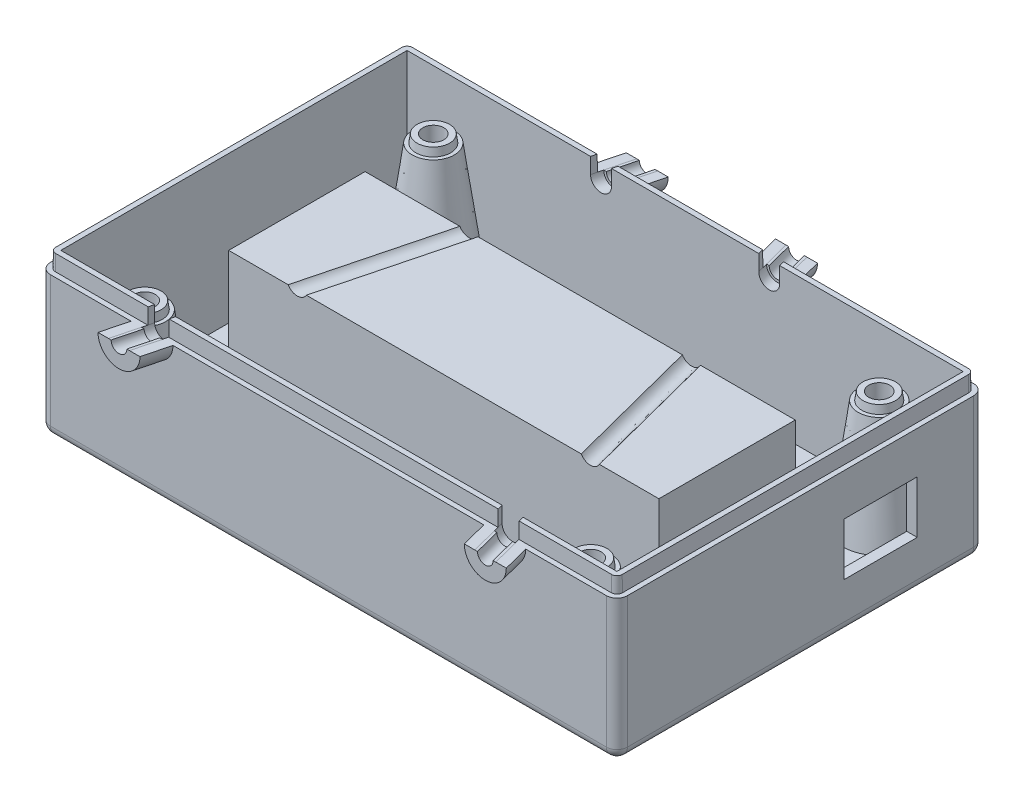
from build123d import *

# Parameters (mm, degrees)
SKETCH2_W           = 110
SKETCH2_H           = 70
BOSS_EXTRUDE1_DEPTH = 30
FILLET1_R           = 2
SKETCH10_W          = 78
SKETCH10_H          = 22
CUT_EXTRUDE2_DEPTH  = 24
CUT_EXTRUDE6_DEPTH  = 2
SKETCH14_R          = 2
CUT_EXTRUDE7_DEPTH  = 6
SHELL1_START        = 4
SHELL1_OUTLINE_W    = 106
SHELL1_OUTLINE_H    = 66
SHELL1_DEPTH        = 26
SHELL1_START_2      = 26
SHELL1_2_DEPTH      = 4
SHELL1_START_3      = 2
SHELL1_3_OUTLINE_W  = 106
SHELL1_3_OUTLINE_H  = 66
SHELL1_3_DEPTH      = 2
SHELL1_START_4      = 10
SHELL1_4_DEPTH      = 16
SKETCH4_OUTSIDE_W   = 138.862
SKETCH4_OUTSIDE_H   = 98.862
CUT_EXTRUDE1_DEPTH  = 3
CUT_EXTRUDE1_DRAFT  = -1
SKETCH11_R          = 2
CUT_EXTRUDE3_DEPTH  = 2
SKETCH12_R          = 2
CUT_EXTRUDE4_DEPTH  = 2
SKETCH29_W          = 14
SKETCH29_H          = 10
CUT_EXTRUDE8_DEPTH  = 5
SKETCH30_W          = 40
SKETCH30_H          = 1.5
CUT_EXTRUDE9_DEPTH  = 10
SKETCH32_W          = 40
SKETCH32_H          = 1.5
CUT_EXTRUDE10_DEPTH = 10


# Read off the part's stored shape, not the designer's step: Shell1, Mounting Boss3, Mounting Boss4, Mounting Boss5, Mounting Boss6
with BuildPart() as part:
    # Sketch2 → Boss-Extrude1 (new body)
    with BuildSketch(Plane(origin=(0, 0, 0), x_dir=(1, 0, 0), z_dir=(0, 1, 0))):
        Rectangle(SKETCH2_W, SKETCH2_H)
    extrude(amount=BOSS_EXTRUDE1_DEPTH)

    # Fillet1
    fillet1_edges = [part.edges().sort_by_distance(p)[0] for p in [
        (0, 0, 35),
        (-55, 0, 0),
        (0, 0, -35),
        (55, 0, 0),
        (55, 15, 35),
        (-55, 15, 35),
        (-55, 15, -35),
        (55, 15, -35),
    ]]
    fillet(fillet1_edges, radius=FILLET1_R)

    # Sketch10 → Cut-Extrude2 (cut)
    with BuildSketch(Plane.XZ):
        Rectangle(SKETCH10_W, SKETCH10_H)
    extrude(amount=-CUT_EXTRUDE2_DEPTH, mode=Mode.SUBTRACT)

    # Sketch13 → Cut-Extrude6 (cut)
    with BuildSketch(Plane.XZ):
        with BuildLine():
            Line((6, -14), (42, -14))
            Line((42, -14), (42, 14))
            Line((42, 14), (6, 14))
            ThreePointArc((6, 14), (0, 20), (-6, 14))
            Line((-6, 14), (-42, 14))
            Line((-42, 14), (-42, -14))
            Line((-42, -14), (-6, -14))
            ThreePointArc((-6, -14), (0, -20), (6, -14))
        make_face()
    extrude(amount=-CUT_EXTRUDE6_DEPTH, mode=Mode.SUBTRACT)

    # Sketch14 → Cut-Extrude7 (cut)
    with BuildSketch(Plane.XZ.offset(-2)):
        with Locations(Location((0, -16, 0), (0, 0, 270))):
            Circle(SKETCH14_R)
        with Locations(Location((0, 16, 0), (0, 0, 270))):
            Circle(SKETCH14_R)
    extrude(amount=-CUT_EXTRUDE7_DEPTH, mode=Mode.SUBTRACT)

    # Shell1 outline → Shell1 (cut)
    with BuildSketch(Plane(origin=(0, 0, 0), x_dir=(1, 0, 0), z_dir=(0, 1, 0)).offset(SHELL1_START)):
        Rectangle(SHELL1_OUTLINE_W, SHELL1_OUTLINE_H)
        with BuildLine():
            Line((2.645751311, 13), (41, 13))
            Line((41, 13), (41, -13))
            Line((41, -13), (2.645751311, -13))
            ThreePointArc((2.645751311, -13), (0, -20), (-2.645751311, -13))
            Line((-2.645751311, -13), (-41, -13))
            Line((-41, -13), (-41, 13))
            Line((-41, 13), (-2.645751311, 13))
            ThreePointArc((-2.645751311, 13), (0, 20), (2.645751311, 13))
        make_face(mode=Mode.SUBTRACT)
    extrude(amount=SHELL1_DEPTH, mode=Mode.SUBTRACT)

    # Shell1 2 outline → Shell1 2 (cut)
    with BuildSketch(Plane(origin=(0, 0, 0), x_dir=(1, 0, 0), z_dir=(0, 1, 0)).offset(SHELL1_START_2)):
        with BuildLine():
            Line((41, -13), (41, 13))
            Line((41, 13), (2.645751311, 13))
            ThreePointArc((2.645751311, 13), (0, 20), (-2.645751311, 13))
            Line((-2.645751311, 13), (-41, 13))
            Line((-41, 13), (-41, -13))
            Line((-41, -13), (-2.645751311, -13))
            ThreePointArc((-2.645751311, -13), (0, -20), (2.645751311, -13))
            Line((2.645751311, -13), (41, -13))
        make_face()
    extrude(amount=SHELL1_2_DEPTH, mode=Mode.SUBTRACT)

    # Shell1 3 outline → Shell1 3 (cut)
    with BuildSketch(Plane(origin=(0, 0, 0), x_dir=(1, 0, 0), z_dir=(0, 1, 0)).offset(SHELL1_START_3)):
        Rectangle(SHELL1_3_OUTLINE_W, SHELL1_3_OUTLINE_H)
        with BuildLine():
            Line((44, -16), (7.745966692, -16))
            ThreePointArc((7.745966692, -16), (0, -22), (-7.745966692, -16))
            Line((-7.745966692, -16), (-44, -16))
            Line((-44, -16), (-44, 16))
            Line((-44, 16), (-7.745966692, 16))
            ThreePointArc((-7.745966692, 16), (0, 22), (7.745966692, 16))
            Line((7.745966692, 16), (44, 16))
            Line((44, 16), (44, -16))
        make_face(mode=Mode.SUBTRACT)
    extrude(amount=SHELL1_3_DEPTH, mode=Mode.SUBTRACT)

    # Shell1 4 outline → Shell1 4 (cut)
    with BuildSketch(Plane(origin=(0, 0, 0), x_dir=(1, 0, 0), z_dir=(0, 1, 0)).offset(SHELL1_START_4)):
        with BuildLine():
            Line((-2.645751311, 13), (2.645751311, 13))
            ThreePointArc((2.645751311, 13), (0, 20), (-2.645751311, 13))
        make_face()
        with BuildLine():
            ThreePointArc((-2.645751311, -13), (0, -20), (2.645751311, -13))
            Line((2.645751311, -13), (-2.645751311, -13))
        make_face()
    extrude(amount=SHELL1_4_DEPTH, mode=Mode.SUBTRACT)


with BuildPart() as cut_extrude1_tool:
    # Sketch4 outside → Cut-Extrude1 (with draft: the straight prism first)
    with BuildSketch(Plane(origin=(0, 30, 0), x_dir=(1, 0, 0), z_dir=(0, 1, 0))):
        Rectangle(SKETCH4_OUTSIDE_W, SKETCH4_OUTSIDE_H)
        with BuildLine():
            Line((54, -33), (54, 33))
            ThreePointArc((54, 33), (53.707106781, 33.707106781), (53, 34))
            Line((53, 34), (-53, 34))
            ThreePointArc((-53, 34), (-53.707106781, 33.707106781), (-54, 33))
            Line((-54, 33), (-54, -33))
            ThreePointArc((-54, -33), (-53.707106781, -33.707106781), (-53, -34))
            Line((-53, -34), (53, -34))
            ThreePointArc((53, -34), (53.707106781, -33.707106781), (54, -33))
        make_face(mode=Mode.SUBTRACT)
    extrude(amount=-CUT_EXTRUDE1_DEPTH)
    # Cut-Extrude1: the draft: its side faces are tilted about the plane it starts from
    cut_extrude1_sides = [cut_extrude1_tool.faces().sort_by_distance(p)[0] for p in [
        (0, 28.5, 49.431),
        (69.431, 28.5, 0),
        (0, 28.5, -49.431),
        (-69.431, 28.5, 0),
        (0, 28.5, 34),
        (-53.707106781, 28.5, 33.707106781),
        (-54, 28.5, 0),
        (-53.707106781, 28.5, -33.707106781),
        (0, 28.5, -34),
        (53.707106781, 28.5, -33.707106781),
        (54, 28.5, 0),
        (53.707106781, 28.5, 33.707106781),
    ]]
    draft(cut_extrude1_sides, Plane(origin=(0, 30, 0), x_dir=(1, 0, 0), z_dir=(0, 1, 0)), CUT_EXTRUDE1_DRAFT)


with BuildPart() as part_1:
    add(part.part)

    # Cut-Extrude1: cut by cut_extrude1_tool
    add(cut_extrude1_tool.part, mode=Mode.SUBTRACT)

    # Mounting Boss3 outline → Mounting Boss3 (revolve, cut)
    with BuildSketch(Plane(origin=(42.5, 0, -27.5), x_dir=(1, 0, 0), z_dir=(0, 0, 1))):
        Polygon((4.222482258, 0), (4.187572131, 1.999999827), (0, 1.999999827), (0, 0), align=None)
    revolve(axis=Axis((42.5, 0, -27.5), (0, 1, 0)), mode=Mode.SUBTRACT)

    # Mounting Boss3 2 outline → Mounting Boss3 2 (revolve)
    with BuildSketch(Plane(origin=(42.5, 0, -27.5), x_dir=(1, 0, 0), z_dir=(0, 0, 1))):
        Polygon((4, 22.746), (3.310811252, 22.746), (3.1, 24.246), (2, 24.246), (2, 12.746), (4, 12.746), (4.187572131, 1.999999827), (6.916385707, 1.999999827), align=None)
    revolve(axis=Axis((42.5, 0, -27.5), (0, 1, 0)))

    # Mounting Boss4 outline → Mounting Boss4 (revolve, cut)
    with BuildSketch(Plane(origin=(42.5, 0, 27.5), x_dir=(1, 0, 0), z_dir=(0, 0, 1))):
        Polygon((4.222482258, 0), (4.187572131, 1.999999827), (0, 1.999999827), (0, 0), align=None)
    revolve(axis=Axis((42.5, 0, 27.5), (0, 1, 0)), mode=Mode.SUBTRACT)

    # Mounting Boss4 2 outline → Mounting Boss4 2 (revolve)
    with BuildSketch(Plane(origin=(42.5, 0, 27.5), x_dir=(1, 0, 0), z_dir=(0, 0, 1))):
        Polygon((4, 22.746), (3.310811252, 22.746), (3.1, 24.246), (2, 24.246), (2, 12.746), (4, 12.746), (4.187572131, 1.999999827), (6.916385707, 1.999999827), align=None)
    revolve(axis=Axis((42.5, 0, 27.5), (0, 1, 0)))

    # Mounting Boss5 outline → Mounting Boss5 (revolve, cut)
    with BuildSketch(Plane(origin=(-42.5, 0, -27.5), x_dir=(1, 0, 0), z_dir=(0, 0, 1))):
        Polygon((4.222482258, 0), (4.187572133, 1.999999739), (0, 1.999999739), (0, 0), align=None)
    revolve(axis=Axis((-42.5, 0, -27.5), (0, 1, 0)), mode=Mode.SUBTRACT)

    # Mounting Boss5 2 outline → Mounting Boss5 2 (revolve)
    with BuildSketch(Plane(origin=(-42.5, 0, -27.5), x_dir=(1, 0, 0), z_dir=(0, 0, 1))):
        Polygon((4, 22.746), (3.310811252, 22.746), (3.1, 24.246), (2, 24.246), (2, 12.746), (4, 12.746), (4.187572133, 1.999999739), (6.916385719, 1.999999739), align=None)
    revolve(axis=Axis((-42.5, 0, -27.5), (0, 1, 0)))

    # Mounting Boss6 outline → Mounting Boss6 (revolve, cut)
    with BuildSketch(Plane(origin=(-42.5, 0, 27.5), x_dir=(1, 0, 0), z_dir=(0, 0, 1))):
        Polygon((4.222482258, 0), (4.187572133, 1.999999739), (0, 1.999999739), (0, 0), align=None)
    revolve(axis=Axis((-42.5, 0, 27.5), (0, 1, 0)), mode=Mode.SUBTRACT)

    # Mounting Boss6 2 outline → Mounting Boss6 2 (revolve)
    with BuildSketch(Plane(origin=(-42.5, 0, 27.5), x_dir=(1, 0, 0), z_dir=(0, 0, 1))):
        Polygon((4, 22.746), (3.310811252, 22.746), (3.1, 24.246), (2, 24.246), (2, 12.746), (4, 12.746), (4.187572133, 1.999999739), (6.916385719, 1.999999739), align=None)
    revolve(axis=Axis((-42.5, 0, 27.5), (0, 1, 0)))

    # Sketch11 → Cut-Extrude3 (cut)
    with BuildSketch(Plane(origin=(41, 0, 0), x_dir=(0, 0, -1), z_dir=(1, 0, 0))):
        with Locations((0, 14)):
            Circle(SKETCH11_R)
    extrude(amount=-CUT_EXTRUDE3_DEPTH, mode=Mode.SUBTRACT)

    # Sketch12 → Cut-Extrude4 (cut)
    with BuildSketch(Plane.ZY.offset(41)):
        with Locations((0, 13)):
            Circle(SKETCH12_R)
    extrude(amount=-CUT_EXTRUDE4_DEPTH, mode=Mode.SUBTRACT)

    # Cut-Sweep2: sweep along a path in Sketch18
    with BuildLine(Plane(origin=(0, 27, 0), x_dir=(1, 0, 0), z_dir=(0, 1, 0))) as cut_sweep2_path:
        Line((-34.913373888, -40), (0, 95))
        Line((0, 95), (34.913373888, -40))
    # Sketch19 → Cut-Sweep2 (sweep, cut)
    with BuildSketch(Plane.XY.offset(40)):
        with BuildLine():
            Line((-36.913373888, 27), (-36.913373888, 34.647863898))
            Line((-36.913373888, 34.647863898), (-32.913373888, 34.647863898))
            Line((-32.913373888, 34.647863898), (-32.913373888, 27))
            ThreePointArc((-32.913373888, 27), (-34.913373888, 25), (-36.913373888, 27))
        make_face()
    sweep(path=cut_sweep2_path.line, transition=Transition.RIGHT, mode=Mode.SUBTRACT)

    # Sweep2: sweep along a path in Sketch22
    with BuildLine(Plane(origin=(0, 27, 0), x_dir=(1, 0, 0), z_dir=(0, 1, 0))) as sweep2_path:
        Line((-33.620285966, -35), (-34.913373888, -40))
    # Sketch21 → Sweep2 (sweep)
    with BuildSketch(Plane.XY.offset(35)):
        with BuildLine():
            Line((-35.620285966, 27), (-35.120285966, 27))
            ThreePointArc((-35.120285966, 27), (-33.620285966, 25.5), (-32.120285966, 27))
            Line((-32.120285966, 27), (-31.620285966, 27))
            Line((-31.620285966, 27), (-29.620285966, 27))
            ThreePointArc((-29.620285966, 27), (-33.620285966, 23), (-37.620285966, 27))
            Line((-37.620285966, 27), (-35.620285966, 27))
        make_face()
    sweep(path=sweep2_path.line)

    # Sweep3: sweep along a path in Sketch24
    with BuildLine(Plane(origin=(0, 27, 0), x_dir=(1, 0, 0), z_dir=(0, 1, 0))) as sweep3_path:
        Line((33.620285966, -35), (34.913373888, -40))
    # Sketch23 → Sweep3 (sweep)
    with BuildSketch(Plane.XY.offset(35)):
        with BuildLine():
            Line((29.620285966, 27), (31.620285966, 27))
            Line((31.620285966, 27), (32.120285966, 27))
            ThreePointArc((32.120285966, 27), (33.620285966, 25.5), (35.120285966, 27))
            Line((35.120285966, 27), (35.620285966, 27))
            Line((35.620285966, 27), (37.620285966, 27))
            ThreePointArc((37.620285966, 27), (33.620285966, 23), (29.620285966, 27))
        make_face()
    sweep(path=sweep3_path.line)

    # Sweep4: sweep along a path in Sketch26
    with BuildLine(Plane(origin=(0, 27, 0), x_dir=(1, 0, 0), z_dir=(0, 1, 0))) as sweep4_path:
        Line((15.517055061, 35), (14.22396714, 40))
    # Sketch25 → Sweep4 (sweep)
    with BuildSketch(Plane(origin=(0, 0, -35), x_dir=(-1, 0, 0), z_dir=(0, 0, -1))):
        with BuildLine():
            Line((-19.517055061, 27), (-17.517055061, 27))
            Line((-17.517055061, 27), (-17.017055061, 27))
            ThreePointArc((-17.017055061, 27), (-15.517055061, 25.5), (-14.017055061, 27))
            Line((-14.017055061, 27), (-13.517055061, 27))
            Line((-13.517055061, 27), (-11.517055061, 27))
            ThreePointArc((-11.517055061, 27), (-15.517055061, 23), (-19.517055061, 27))
        make_face()
    sweep(path=sweep4_path.line)

    # Sweep6: sweep along a path in Sketch28
    with BuildLine(Plane(origin=(0, 27, 0), x_dir=(1, 0, 0), z_dir=(0, 1, 0))) as sweep6_path:
        Line((-15.517055061, 35), (-14.22396714, 40))
    # Sketch27 → Sweep6 (sweep)
    with BuildSketch(Plane(origin=(0, 0, -35), x_dir=(-1, 0, 0), z_dir=(0, 0, -1))):
        with BuildLine():
            Line((13.517055061, 27), (14.017055061, 27))
            ThreePointArc((14.017055061, 27), (15.517055061, 25.5), (17.017055061, 27))
            Line((17.017055061, 27), (17.517055061, 27))
            Line((17.517055061, 27), (19.517055061, 27))
            ThreePointArc((19.517055061, 27), (15.517055061, 23), (11.517055061, 27))
            Line((11.517055061, 27), (13.517055061, 27))
        make_face()
    sweep(path=sweep6_path.line)

    # Sketch29 → Cut-Extrude8 (cut)
    with BuildSketch(Plane(origin=(55, 0, 0), x_dir=(0, 0, -1), z_dir=(1, 0, 0))):
        with Locations((15.241883596, 14)):
            Rectangle(SKETCH29_W, SKETCH29_H)
    extrude(amount=-CUT_EXTRUDE8_DEPTH, mode=Mode.SUBTRACT)

    # Sketch30 → Cut-Extrude9 (cut)
    with BuildSketch(Plane.XZ):
        with Locations((-1.924186955, -28.973190451)):
            Rectangle(SKETCH30_W, SKETCH30_H)
    extrude(amount=-CUT_EXTRUDE9_DEPTH, mode=Mode.SUBTRACT)

    # Sketch32 → Cut-Extrude10 (cut)
    with BuildSketch(Plane.XZ):
        with Locations((-2.585814551, 28)):
            Rectangle(SKETCH32_W, SKETCH32_H)
    extrude(amount=-CUT_EXTRUDE10_DEPTH, mode=Mode.SUBTRACT)


solid = part_1.part
